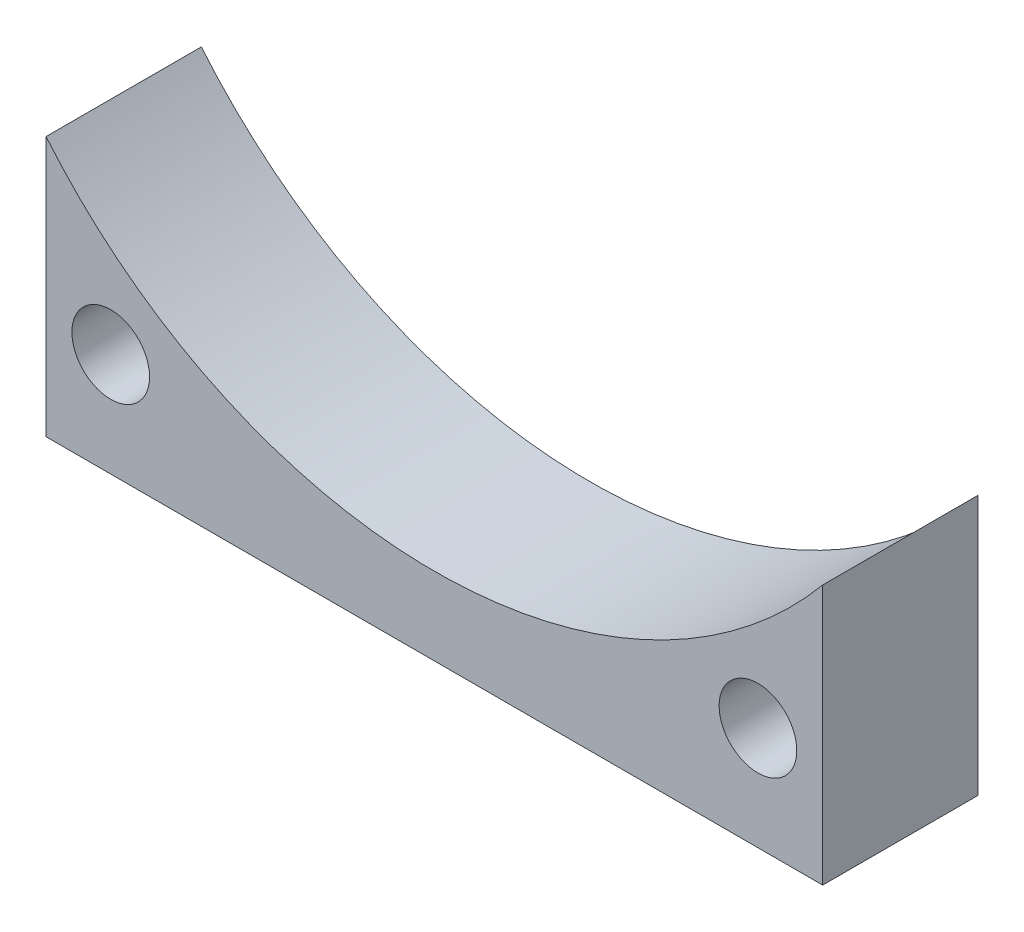
from build123d import *

# Parameters (mm, degrees)
ESQUISSE1_W                  = 60
ESQUISSE1_H                  = 25
BOSS_EXTRU_1_DEPTH           = 12
ENL_V_MAT_EXTRU_1_DEPTH      = 67.098411479
ENL_V_MAT_EXTRU_1_DEPTH_BACK = 67.098411479
ESQUISSE2_R                  = 3
ENL_V_MAT_EXTRU_2_REACH      = 68.098
ESQUISSE3_R                  = 39


with BuildPart() as part:
    # Esquisse1 → Boss.-Extru.1 (new body)
    with BuildSketch(Plane.XY):
        with Locations((30, 12.5)):
            Rectangle(ESQUISSE1_W, ESQUISSE1_H)
    extrude(amount=BOSS_EXTRU_1_DEPTH)

    # Esquisse2 → Enlèv. mat.-Extru.1 (cut, two sides: drawn at the far end of the back side and taken through both)
    with BuildSketch(Plane.XY.offset(12).offset(-ENL_V_MAT_EXTRU_1_DEPTH_BACK)):
        with Locations((5, 8)):
            Circle(ESQUISSE2_R)
        with Locations((55, 8)):
            Circle(ESQUISSE2_R)
    extrude(amount=ENL_V_MAT_EXTRU_1_DEPTH + ENL_V_MAT_EXTRU_1_DEPTH_BACK, mode=Mode.SUBTRACT)

    # Esquisse3 → Enlèv. mat.-Extru.2 (cut, up to next)
    with BuildSketch(Plane.XY.offset(12), mode=Mode.PRIVATE) as enl_v_mat_extru_2_sk1:
        with Locations((30, 45)):
            Circle(ESQUISSE3_R)
    enl_v_mat_extru_2_tool1 = extrude(enl_v_mat_extru_2_sk1.sketch, amount=-ENL_V_MAT_EXTRU_2_REACH, mode=Mode.PRIVATE) & part.part
    add(enl_v_mat_extru_2_tool1.solids().sort_by_distance((30, 45, 12))[0], mode=Mode.SUBTRACT)


solid = part.part
